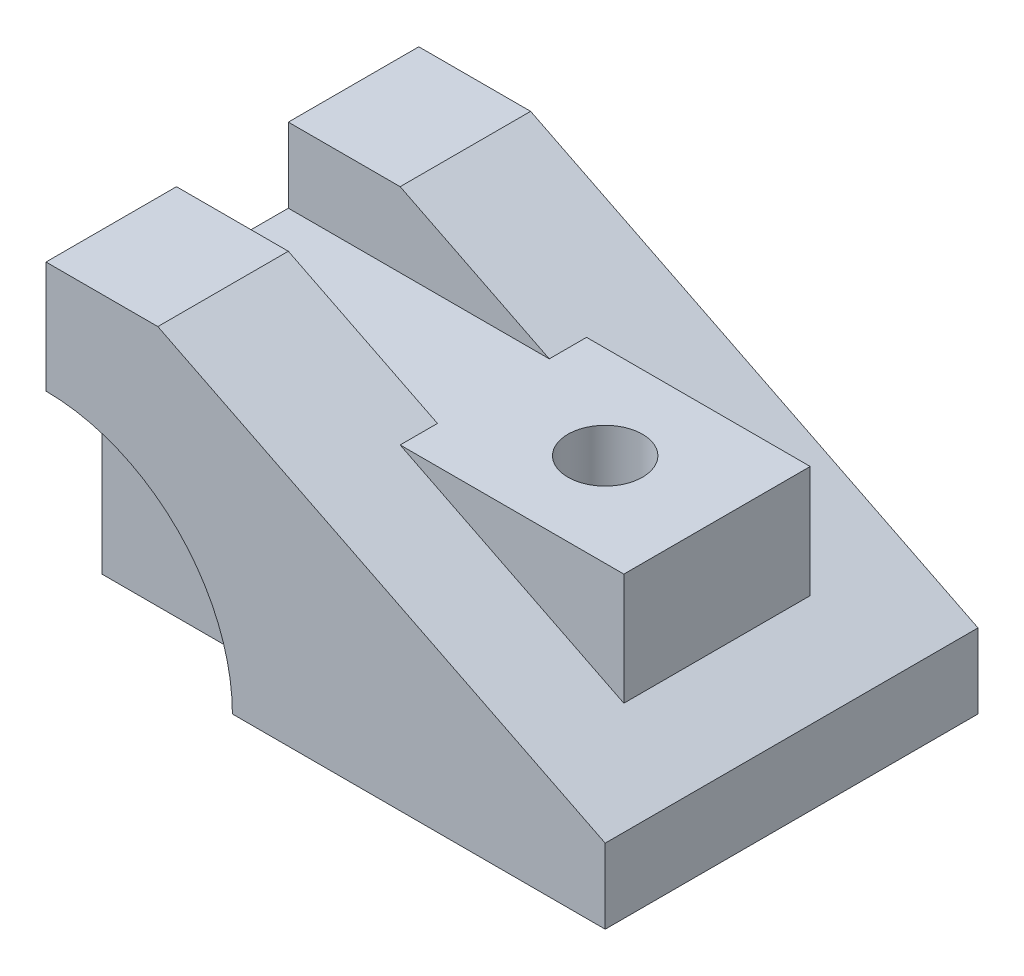
from build123d import *

# Parameters (mm, degrees)
BOSS_EXTRUDE1_DEPTH      = 50
BOSS_EXTRUDE1_DEPTH_BACK = 50
SKETCH2_R                = 50
CUT_EXTRUDE1_DEPTH       = 15
BOSS_EXTRUDE2_DEPTH      = 25
BOSS_EXTRUDE2_DEPTH_BACK = 25
SKETCH4_R                = 10
CUT_EXTRUDE2_DEPTH       = 170.115345253
SKETCH5_W                = 133.233109364
SKETCH5_H                = 30
CUT_EXTRUDE3_DEPTH       = 20


with BuildPart() as part:
    # Sketch1 → Boss-Extrude1 (new, two sides: drawn at the far end of the back side and taken through both)
    with BuildSketch(Plane.XY.offset(-BOSS_EXTRUDE1_DEPTH_BACK)):
        Polygon((0, 0), (150, 0), (150, 20), (30, 80), (0, 80), align=None)
    extrude(amount=BOSS_EXTRUDE1_DEPTH + BOSS_EXTRUDE1_DEPTH_BACK)

    # Sketch2 → Cut-Extrude1 (cut)
    with BuildSketch(Plane.XY.offset(50)):
        Circle(SKETCH2_R)
    extrude(amount=-CUT_EXTRUDE1_DEPTH, mode=Mode.SUBTRACT)

    # Sketch3 → Boss-Extrude2 (add, two sides: drawn at the far end of the back side and taken through both)
    with BuildSketch(Plane.XY.offset(-BOSS_EXTRUDE2_DEPTH_BACK)):
        Polygon((70, 60), (130, 60), (130, 30), align=None)
    extrude(amount=BOSS_EXTRUDE2_DEPTH + BOSS_EXTRUDE2_DEPTH_BACK)

    # Sketch4 → Cut-Extrude2 (cut, through all)
    with BuildSketch(Plane(origin=(0, 60, 0), x_dir=(1, 0, 0), z_dir=(0, 1, 0))):
        with Locations((100, 0)):
            Circle(SKETCH4_R)
    extrude(amount=-CUT_EXTRUDE2_DEPTH, mode=Mode.SUBTRACT)

    # Sketch5 → Cut-Extrude3 (cut)
    with BuildSketch(Plane(origin=(0, 80, 0), x_dir=(1, 0, 0), z_dir=(0, 1, 0))):
        with Locations((16.458179219, 0)):
            Rectangle(SKETCH5_W, SKETCH5_H)
    extrude(amount=-CUT_EXTRUDE3_DEPTH, mode=Mode.SUBTRACT)


solid = part.part
